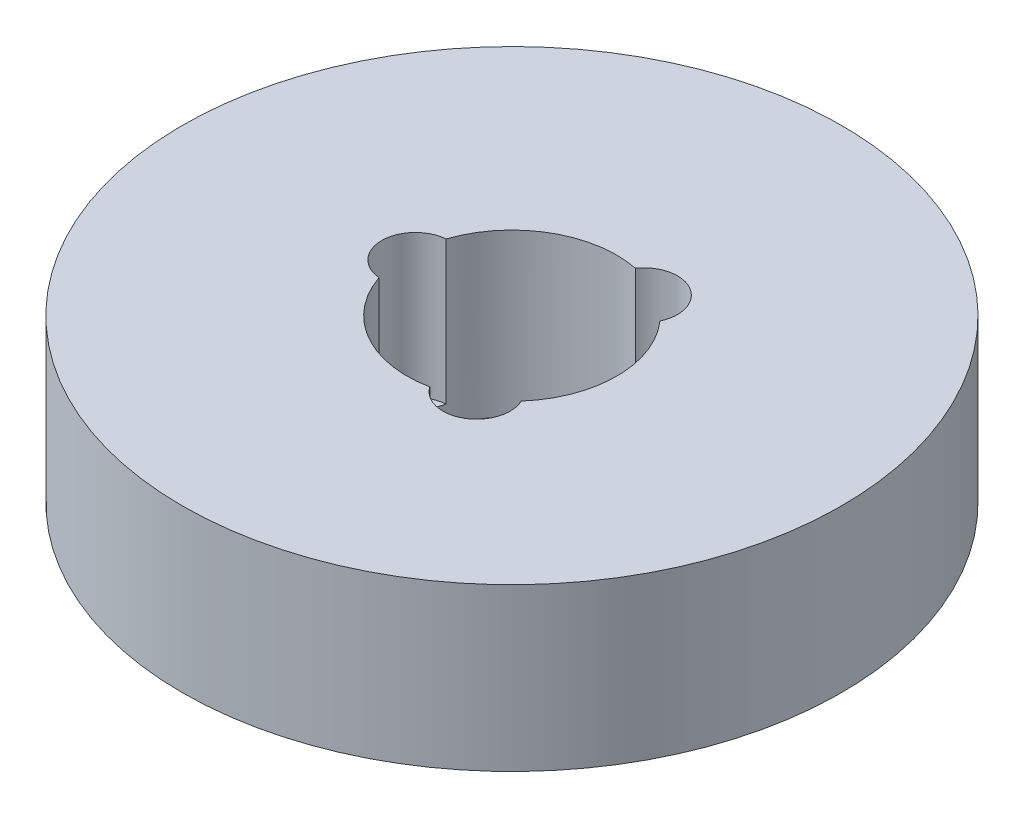
from build123d import *

# Parameters (mm, degrees)
SKETCH1_R           = 55
BOSS_EXTRUDE1_DEPTH = 27
SKETCH2_R           = 17.5
CUT_EXTRUDE1_DEPTH  = 83.33468285
SKETCH3_R           = 5.609144045
CUT_EXTRUDE2_DEPTH  = 23.86019443
CIRPATTERN1_COUNT   = 3


with BuildPart() as part:
    # Sketch1 → Boss-Extrude1 (new body)
    with BuildSketch(Plane(origin=(0, 0, 0), x_dir=(1, 0, 0), z_dir=(0, 1, 0))):
        Circle(SKETCH1_R)
    extrude(amount=BOSS_EXTRUDE1_DEPTH)

    # Sketch2 → Cut-Extrude1 (cut, through all)
    with BuildSketch(Plane(origin=(0, 0, 0), x_dir=(1, 0, 0), z_dir=(0, 1, 0))):
        Circle(SKETCH2_R)
    extrude(amount=CUT_EXTRUDE1_DEPTH, mode=Mode.SUBTRACT)

    # Sketch3 → Cut-Extrude2 (cut)
    with BuildSketch(Plane(origin=(0, 27, 0), x_dir=(1, 0, 0), z_dir=(0, 1, 0))):
        with Locations((-16.117619445, 0)):
            Circle(SKETCH3_R)
    cut_extrude2 = extrude(amount=-CUT_EXTRUDE2_DEPTH, mode=Mode.SUBTRACT)

    # CirPattern1: Cut-Extrude2 ×3 about axis
    cirpattern1_axis = Axis((0, 0, 0), (0, 1, 0))
    for i in range(1, CIRPATTERN1_COUNT):
        add(cut_extrude2.rotate(cirpattern1_axis, i * 360 / CIRPATTERN1_COUNT), mode=Mode.SUBTRACT)


solid = part.part
